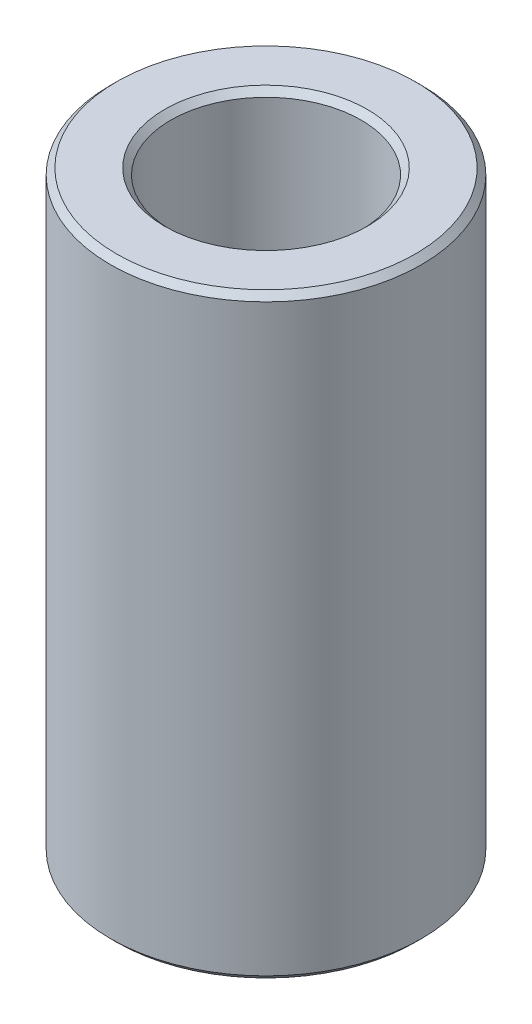
from build123d import *

# Parameters (mm, degrees)
SKETCH1_R           = 42.5
BOSS_EXTRUDE1_DEPTH = 162.932795171
SKETCH2_R           = 26.015468726
CUT_EXTRUDE1_DEPTH  = 174.665182873
CHAMFER1_SIZE       = 1.684804274


with BuildPart() as part:
    # Sketch1 → Boss-Extrude1 (new body)
    with BuildSketch(Plane(origin=(0, 0, 0), x_dir=(1, 0, 0), z_dir=(0, 1, 0))):
        Circle(SKETCH1_R)
    extrude(amount=BOSS_EXTRUDE1_DEPTH)

    # Sketch2 → Cut-Extrude1 (cut, through all)
    with BuildSketch(Plane(origin=(0, 0, 0), x_dir=(1, 0, 0), z_dir=(0, 1, 0))):
        Circle(SKETCH2_R)
    extrude(amount=CUT_EXTRUDE1_DEPTH, mode=Mode.SUBTRACT)

    # Chamfer1
    chamfer1_edges = [part.edges().sort_by_distance(p)[0] for p in [
        (-26.015468726, 162.932795171, 0),
        (-26.015468726, 0, 0),
        (-42.5, 0, 0),
        (-42.5, 162.932795171, 0),
    ]]
    chamfer(chamfer1_edges, length=CHAMFER1_SIZE)


solid = part.part
